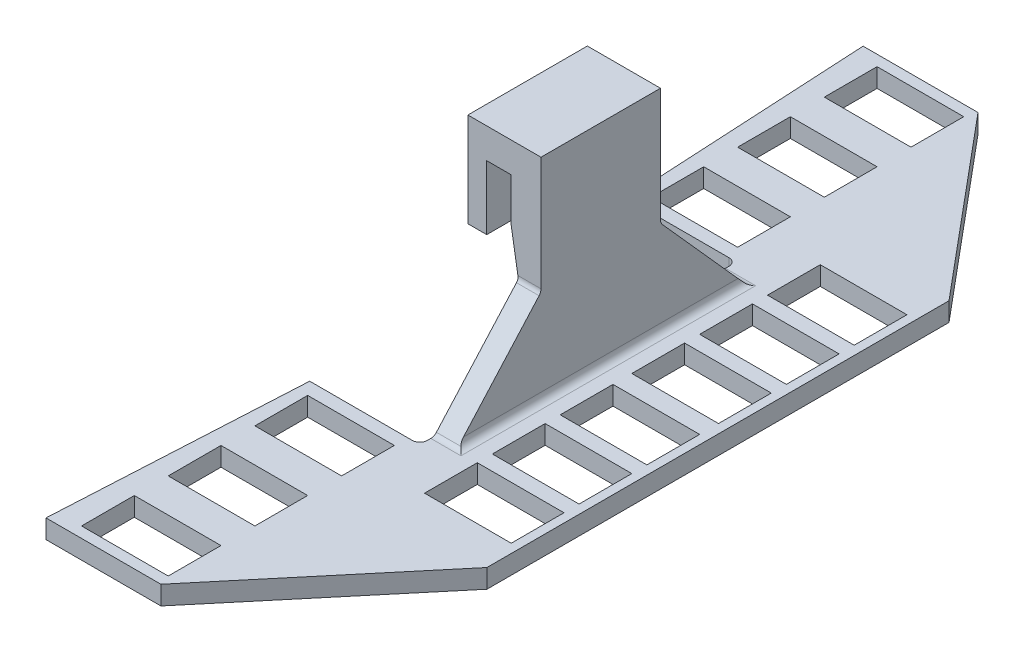
from build123d import *

# Parameters (mm, degrees)
RESSALTO_EXTRUS_O1_DEPTH  = 2.5
ESBO_O2_W                 = 3
ESBO_O2_H                 = 66
RESSALTO_EXTRUS_O2_DEPTH  = 12.5
ESBO_O4_W                 = 4
ESBO_O4_H                 = 11.5
ESBO_O4_W_2               = 2.5
ESBO_O4_H_2               = 8.5
RESSALTO_EXTRUS_O4_DEPTH  = 7.925
CHANFRO1_SIZE2            = 6
CHANFRO1_SIZE             = 1
CHANFRO2_SIZE             = 12
CORTE_EXTRUS_O2_DEPTH     = 3
CORTE_EXTRUS_O1_REACH     = 67.702
ESBO_O5_W                 = 11.5
ESBO_O5_H                 = 7
PADR_O_LINEAR1_COUNT      = 3
PADR_O_LINEAR1_PITCH      = 9
ESBO_O8_W                 = 11.5
ESBO_O8_H                 = 7
CORTE_EXTRUS_O4_DEPTH     = 10
PADR_O_LINEAR3_COUNT      = 3
PADR_O_LINEAR3_PITCH      = 11.5
ESPELHAR1_COPY_1_SKETCH_W = 11.5
ESPELHAR1_COPY_1_SKETCH_H = 7
ESPELHAR1_COPY_1_DEPTH    = 10
ESPELHAR1_COPY_2_SKETCH_W = 11.5
ESPELHAR1_COPY_2_SKETCH_H = 7
ESPELHAR1_COPY_2_DEPTH    = 10
ESPELHAR2_COPY_1_REACH    = 67.702
ESPELHAR2_COPY_1_SKETCH_W = 11.5
ESPELHAR2_COPY_1_SKETCH_H = 7
ESPELHAR2_COPY_2_REACH    = 67.702
ESPELHAR2_COPY_2_SKETCH_W = 11.5
ESPELHAR2_COPY_2_SKETCH_H = 7
FILETE3_R                 = 1
FILETE5_R                 = 1


# Some blends are built 0.0001 mm under size
with BuildPart() as part:
    # Esboço1 → Ressalto-extrusão1 (new body)
    with BuildSketch(Plane(origin=(0, 0, 0), x_dir=(1, 0, 0), z_dir=(0, 1, 0))):
        Polygon((-24.393815238, -54.2), (-9.15, -54.2), (10.553192421, -30.65), (10.553192421, 30.65), (-9.15, 54.2), (-24.393815238, 54.2), (-22.610275313, 21), (-8, 21), (-8, -21), (-22.610275313, -21), align=None)
    extrude(amount=RESSALTO_EXTRUS_O1_DEPTH)

    # Esboço2 → Ressalto-extrusão2 (add)
    with BuildSketch(Plane(origin=(0, 2.5, 0), x_dir=(1, 0, 0), z_dir=(0, 1, 0))):
        with Locations((-6.5, 0)):
            Rectangle(ESBO_O2_W, ESBO_O2_H)
    extrude(amount=RESSALTO_EXTRUS_O2_DEPTH)

    # Esboço4 → Ressalto-extrusão4 (add, symmetric)
    with BuildSketch(Plane.XY):
        with Locations((-7, 20.75)):
            Rectangle(ESBO_O4_W, ESBO_O4_H)
        Polygon((-9, 26.5), (-5, 26.5), (-5, 30.5), (-14.7, 30.5), (-14.7, 26.5), (-12.2, 26.5), align=None)
        with Locations((-13.45, 22.25)):
            Rectangle(ESBO_O4_W_2, ESBO_O4_H_2)
    extrude(amount=RESSALTO_EXTRUS_O4_DEPTH, both=True)

    # Chanfro1
    chanfro1_edges = [part.edges().sort_by_distance(p)[0] for p in [
        (-9, 15, 0),
    ]]
    chanfro1_side = [part.faces().sort_by_distance(p)[0] for p in [
        (-8.98, 15, 0),
    ]]
    chamfer(chanfro1_edges, length=CHANFRO1_SIZE - 0.0001, length2=CHANFRO1_SIZE2 - 0.0001, reference=chanfro1_side[0])  # a hair under: the kernel refuses the full size

    # Chanfro2
    chanfro2_edges = [part.edges().sort_by_distance(p)[0] for p in [
        (-6.5, 15, 33),
        (-6.5, 15, -33),
    ]]
    chamfer(chanfro2_edges, length=CHANFRO2_SIZE)

    # Esboço6 → Corte-extrusão2 (cut)
    with BuildSketch(Plane(origin=(-5, 0, 0), x_dir=(0, 0, -1), z_dir=(1, 0, 0))):
        Polygon((-7.92, 15), (-33, 15), (-33, 2.5), (-19.1, 2.5), align=None)
    corte_extrus_o2 = extrude(amount=-CORTE_EXTRUS_O2_DEPTH, mode=Mode.SUBTRACT)

    # Esboço5 → Corte-extrusão1 (cut, up to next)
    with BuildSketch(Plane(origin=(0, 2.5, 0), x_dir=(1, 0, 0), z_dir=(0, 1, 0)), mode=Mode.PRIVATE) as corte_extrus_o1_sk1:
        with Locations((3.624348025, -4.75)):
            Rectangle(ESBO_O5_W, ESBO_O5_H)
    corte_extrus_o1_tool1 = extrude(corte_extrus_o1_sk1.sketch, amount=-CORTE_EXTRUS_O1_REACH, mode=Mode.PRIVATE) & part.part
    corte_extrus_o1 = corte_extrus_o1_tool1.solids().sort_by_distance((3.624348, 2.5, 4.75))[0]
    add(corte_extrus_o1, mode=Mode.SUBTRACT)

    # Padrão linear1: Corte-extrusão1 ×3
    with Locations(*[(0, 0, i * PADR_O_LINEAR1_PITCH) for i in range(1, PADR_O_LINEAR1_COUNT)]):
        add(corte_extrus_o1, mode=Mode.SUBTRACT)

    # Esboço8 → Corte-extrusão4 (cut)
    with BuildSketch(Plane(origin=(0, 2.5, 0), x_dir=(1, 0, 0), z_dir=(0, 1, 0))):
        with Locations((-15.36, 26.27)):
            Rectangle(ESBO_O8_W, ESBO_O8_H)
    corte_extrus_o4 = extrude(amount=-CORTE_EXTRUS_O4_DEPTH, mode=Mode.SUBTRACT)

    # Padrão linear3: Corte-extrusão4 ×3
    with Locations(*[(0, 0, -i * PADR_O_LINEAR3_PITCH) for i in range(1, PADR_O_LINEAR3_COUNT)]):
        add(corte_extrus_o4, mode=Mode.SUBTRACT)

    # Espelhar1: Corte-extrusão4 across plane
    add(corte_extrus_o4.mirror(Plane.XY), mode=Mode.SUBTRACT)

    # Espelhar1 copy 1 sketch → Espelhar1 copy 1 (cut)
    with BuildSketch(Plane(origin=(0, 2.5, 11.5), x_dir=(1, 0, 0), z_dir=(0, 1, 0))):
        with Locations((-15.36, -26.27)):
            Rectangle(ESPELHAR1_COPY_1_SKETCH_W, ESPELHAR1_COPY_1_SKETCH_H)
    extrude(amount=-ESPELHAR1_COPY_1_DEPTH, mode=Mode.SUBTRACT)

    # Espelhar1 copy 2 sketch → Espelhar1 copy 2 (cut)
    with BuildSketch(Plane(origin=(0, 2.5, 23), x_dir=(1, 0, 0), z_dir=(0, 1, 0))):
        with Locations((-15.36, -26.27)):
            Rectangle(ESPELHAR1_COPY_2_SKETCH_W, ESPELHAR1_COPY_2_SKETCH_H)
    extrude(amount=-ESPELHAR1_COPY_2_DEPTH, mode=Mode.SUBTRACT)

    # Espelhar2: Corte-extrusão1 across plane
    add(corte_extrus_o1.mirror(Plane.XY), mode=Mode.SUBTRACT)

    # Espelhar2 copy 1 sketch → Espelhar2 copy 1 (cut, up to next)
    with BuildSketch(Plane(origin=(0, 2.5, -9), x_dir=(1, 0, 0), z_dir=(0, 1, 0)), mode=Mode.PRIVATE) as espelhar2_copy_1_sk1:
        with Locations((3.624348025, 4.75)):
            Rectangle(ESPELHAR2_COPY_1_SKETCH_W, ESPELHAR2_COPY_1_SKETCH_H)
    espelhar2_copy_1_tool1 = extrude(espelhar2_copy_1_sk1.sketch, amount=-ESPELHAR2_COPY_1_REACH, mode=Mode.PRIVATE) & part.part
    add(espelhar2_copy_1_tool1.solids().sort_by_distance((3.624348, 2.5, -13.75))[0], mode=Mode.SUBTRACT)

    # Espelhar2 copy 2 sketch → Espelhar2 copy 2 (cut, up to next)
    with BuildSketch(Plane(origin=(0, 2.5, -18), x_dir=(1, 0, 0), z_dir=(0, 1, 0)), mode=Mode.PRIVATE) as espelhar2_copy_2_sk1:
        with Locations((3.624348025, 4.75)):
            Rectangle(ESPELHAR2_COPY_2_SKETCH_W, ESPELHAR2_COPY_2_SKETCH_H)
    espelhar2_copy_2_tool1 = extrude(espelhar2_copy_2_sk1.sketch, amount=-ESPELHAR2_COPY_2_REACH, mode=Mode.PRIVATE) & part.part
    add(espelhar2_copy_2_tool1.solids().sort_by_distance((3.624348, 2.5, -22.75))[0], mode=Mode.SUBTRACT)

    # Espelhar3: Corte-extrusão2 across plane
    add(corte_extrus_o2.mirror(Plane.XY), mode=Mode.SUBTRACT)

    # Filete3
    # the kernel refuses this fillet: 1 mm, written as the material it adds along each edge
    with BuildSketch(Plane(origin=(-8, 0, 21), x_dir=(-1, 0, 0), z_dir=(0, 1, 0)), Plane(origin=(-8, 0, -21), x_dir=(0, 0, 1), z_dir=(0, 1, 0))) as filete3_piece_1:
        with BuildLine():
            CenterArc((FILETE3_R, -FILETE3_R), FILETE3_R, 90, 90)
            Line((0, -FILETE3_R), (0, 0))
            Line((0, 0), (FILETE3_R, 0))
        make_face()
    extrude(amount=2.5)
    with BuildSketch(Plane(origin=(-5, 2.5, 19.1), x_dir=(0, 0, 1), z_dir=(-1, 0, 0))) as filete3_piece_2:
        with BuildLine():
            CenterArc((FILETE3_R * 0.44722265932, FILETE3_R), FILETE3_R, 221.809449368, 48.190550632)
            Line((-FILETE3_R * 0.298143403972, FILETE3_R * 0.333344592992), (0, 0))
            Line((0, 0), (FILETE3_R * 0.44722265932, 0))
        make_face()
    extrude(amount=3)
    with BuildSketch(Plane(origin=(-5, 2.5, -19.1), x_dir=(0, 0, -1), z_dir=(-1, 0, 0))) as filete3_piece_3:
        with BuildLine():
            CenterArc((FILETE3_R * 0.44722265932, -FILETE3_R), FILETE3_R, 90, 48.190550632)
            Line((-FILETE3_R * 0.298143403972, -FILETE3_R * 0.333344592992), (0, 0))
            Line((0, 0), (FILETE3_R * 0.44722265932, 0))
        make_face()
    extrude(amount=3)
    with BuildSketch(Plane(origin=(-5, 2.5, 21.6), x_dir=(1, 0, 0), z_dir=(0, 0, -1))) as filete3_piece_4_section:
        with BuildLine():
            CenterArc((FILETE3_R, -FILETE3_R), FILETE3_R, 90, 90)
            Line((0, -FILETE3_R), (0, 0))
            Line((0, 0), (FILETE3_R, 0))
        make_face()
    filete3_piece_4 = extrude(amount=43.2, mode=Mode.PRIVATE)
    filete3_piece_4 = split(filete3_piece_4, bisect_by=Plane(origin=(-5, 1.257744209, 20.211073579), z_dir=(0, -0.6666554070080641, -0.7453660632916638)), keep=Keep.TOP, mode=Mode.PRIVATE)
    filete3_piece_4 = split(filete3_piece_4, bisect_by=Plane(origin=(-5, 22.723924273, -1.01172213), z_dir=(0, -0.6666554070080641, 0.7453660632916638)), keep=Keep.TOP, mode=Mode.PRIVATE)
    add(filete3_piece_4)
    with BuildSketch(Plane(origin=(-5, 2.5, 21.6), x_dir=(1, 0, 0), z_dir=(0, 0, -1))) as filete3_piece_5a_section:
        with BuildLine():
            CenterArc((FILETE3_R, -FILETE3_R), FILETE3_R, 90, 90)
            Line((0, -FILETE3_R), (0, 0))
            Line((0, 0), (FILETE3_R, 0))
        make_face()
    filete3_piece_5a = extrude(amount=43.2, mode=Mode.PRIVATE)
    filete3_piece_5a = split(filete3_piece_5a, bisect_by=Plane(origin=(-5, 1.257744209, 20.211073579), z_dir=(0, 0.6666554070080641, 0.7453660632916638)), keep=Keep.TOP, mode=Mode.PRIVATE)
    with BuildSketch(Plane(origin=(-3.881943352, 2.5, 19.1), x_dir=(0, 0, 1), z_dir=(-1, 0, 0))) as filete3_piece_5b_section:
        with BuildLine():
            CenterArc((FILETE3_R * 0.44722265932, FILETE3_R), FILETE3_R, 221.809449368, 48.190550632)
            Line((-FILETE3_R * 0.298143403972, FILETE3_R * 0.333344592992), (0, 0))
            Line((0, 0), (FILETE3_R * 0.44722265932, 0))
        make_face()
    filete3_piece_5b = extrude(amount=4.118056648, mode=Mode.PRIVATE)
    filete3_piece_5b = split(filete3_piece_5b, bisect_by=Plane(origin=(-5, 2.5, 19.1), z_dir=(1, 0, 0)), keep=Keep.TOP, mode=Mode.PRIVATE)
    filete3_piece_5 = filete3_piece_5a & filete3_piece_5b
    add(filete3_piece_5)
    with BuildSketch(Plane(origin=(-3.881943352, 2.5, -19.1), x_dir=(0, 0, -1), z_dir=(-1, 0, 0))) as filete3_piece_6a_section:
        with BuildLine():
            CenterArc((FILETE3_R * 0.44722265932, -FILETE3_R), FILETE3_R, 90, 48.190550632)
            Line((-FILETE3_R * 0.298143403972, -FILETE3_R * 0.333344592992), (0, 0))
            Line((0, 0), (FILETE3_R * 0.44722265932, 0))
        make_face()
    filete3_piece_6a = extrude(amount=4.118056648, mode=Mode.PRIVATE)
    filete3_piece_6a = split(filete3_piece_6a, bisect_by=Plane(origin=(-5, 2.5, -19.1), z_dir=(1, 0, 0)), keep=Keep.TOP, mode=Mode.PRIVATE)
    with BuildSketch(Plane(origin=(-5, 2.5, 21.6), x_dir=(1, 0, 0), z_dir=(0, 0, -1))) as filete3_piece_6b_section:
        with BuildLine():
            CenterArc((FILETE3_R, -FILETE3_R), FILETE3_R, 90, 90)
            Line((0, -FILETE3_R), (0, 0))
            Line((0, 0), (FILETE3_R, 0))
        make_face()
    filete3_piece_6b = extrude(amount=43.2, mode=Mode.PRIVATE)
    filete3_piece_6b = split(filete3_piece_6b, bisect_by=Plane(origin=(-5, 22.723924273, -1.01172213), z_dir=(0, 0.6666554070080641, -0.7453660632916638)), keep=Keep.TOP, mode=Mode.PRIVATE)
    filete3_piece_6 = filete3_piece_6a & filete3_piece_6b
    add(filete3_piece_6)
    # the kernel refuses this fillet: 1 mm, written as the material it takes off along each edge
    with BuildSketch(Plane(origin=(-4.750312696, 15, -7.925), x_dir=(0, 0, 1), z_dir=(-1, 0, 0))) as filete3_2_piece_1:
        with BuildLine():
            CenterArc((1, 0.099874922), FILETE3_R, 180, 5.731967965)
            Line((0, 0.099874922), (0, 0))
            Line((0, 0), (0.005, 0))
        make_face()
    extrude(amount=3.499374609, mode=Mode.SUBTRACT)
    with BuildSketch(Plane(origin=(-4.750312696, 15, 7.925), x_dir=(0, 0, -1), z_dir=(-1, 0, 0))) as filete3_2_piece_2:
        with BuildLine():
            CenterArc((1, -0.099874922), FILETE3_R, 174.268032035, 5.731967965)
            Line((0, -0.099874922), (0, 0))
            Line((0, 0), (0.005, 0))
        make_face()
    extrude(amount=3.499374609, mode=Mode.SUBTRACT)

    # Filete5
    # the kernel refuses this fillet: 1 mm, written as the material it adds along each edge
    with BuildSketch(Plane(origin=(-5, 15, -7.92), x_dir=(0, -0.7453660632967485, -0.666655407002379), z_dir=(-1, 0, 0))) as filete5_piece_1_section:
        with BuildLine():
            CenterArc((0.389457483, -1), FILETE5_R, 90, 41.809449368)
            Line((-0.277197924, -0.254633937), (-0.343863465, -0.18009733))
            ThreePointArc((-0.343863465, -0.18009733), (-0.137775641, 0.004227619), (-0.073776551, 0.067505708))
            Line((-0.073776551, 0.067505708), (0, 0.1))
            Line((0, 0.1), (0.389457483, 0.1))
            Line((0.389457483, 0.1), (0.389457483, 0))
        make_face()
    filete5_piece_1 = extrude(amount=3, mode=Mode.PRIVATE)
    filete5_piece_1 = split(filete5_piece_1, bisect_by=Plane(origin=(-5, 15, -7.92), z_dir=(0, -1, 0)), keep=Keep.TOP, mode=Mode.PRIVATE)
    filete5_piece_1 = split(filete5_piece_1, bisect_by=Plane(origin=(-7.919029365, 14.513535649, -7.92), z_dir=(0.9863961453920427, 0.1643856573905407, 0)), keep=Keep.TOP, mode=Mode.PRIVATE)
    add(filete5_piece_1)
    with BuildSketch(Plane(origin=(-5, 15, -7.92), x_dir=(0, -0.7453660632967485, -0.666655407002379), z_dir=(-1, 0, 0))) as filete5_piece_2_section:
        with BuildLine():
            CenterArc((0.389457483, -1), FILETE5_R, 90, 41.809449368)
            Line((-0.277197924, -0.254633937), (-0.343863465, -0.18009733))
            ThreePointArc((-0.343863465, -0.18009733), (-0.137775641, 0.004227619), (-0.073776551, 0.067505708))
            Line((-0.073776551, 0.067505708), (0, 0.1))
            Line((0, 0.1), (0.389457483, 0.1))
            Line((0.389457483, 0.1), (0.389457483, 0))
        make_face()
    filete5_piece_2 = extrude(amount=3, mode=Mode.PRIVATE)
    filete5_piece_2 = split(filete5_piece_2, bisect_by=Plane(origin=(-5, 15, -7.92), z_dir=(0, 1, 0)), keep=Keep.TOP, mode=Mode.PRIVATE)
    add(filete5_piece_2)
    with BuildSketch(Plane(origin=(-5, 15, -7.92), x_dir=(0, -0.7453660632967485, -0.666655407002379), z_dir=(-1, 0, 0))) as filete5_piece_3_section:
        with BuildLine():
            CenterArc((0.389457483, -1), FILETE5_R, 90, 41.809449368)
            Line((-0.277197924, -0.254633937), (-0.343863465, -0.18009733))
            ThreePointArc((-0.343863465, -0.18009733), (-0.137775641, 0.004227619), (-0.073776551, 0.067505708))
            Line((-0.073776551, 0.067505708), (0, 0.1))
            Line((0, 0.1), (0.389457483, 0.1))
            Line((0.389457483, 0.1), (0.389457483, 0))
        make_face()
    filete5_piece_3 = extrude(amount=3, mode=Mode.PRIVATE)
    filete5_piece_3 = split(filete5_piece_3, bisect_by=Plane(origin=(-7.919029365, 14.513535649, -7.92), z_dir=(-0.9863961453920427, -0.1643856573905407, 0)), keep=Keep.TOP, mode=Mode.PRIVATE)
    add(filete5_piece_3)
    with BuildSketch(Plane(origin=(-5, 15, -7.92), x_dir=(0, -0.7453660632967485, -0.666655407002379), z_dir=(-1, 0, 0))) as filete5_piece_4_section:
        with BuildLine():
            CenterArc((0.389457483, -1), FILETE5_R, 90, 41.809449368)
            Line((-0.277197924, -0.254633937), (-0.343863465, -0.18009733))
            ThreePointArc((-0.343863465, -0.18009733), (-0.137775641, 0.004227619), (-0.073776551, 0.067505708))
            Line((-0.073776551, 0.067505708), (0, 0.1))
            Line((0, 0.1), (0.389457483, 0.1))
            Line((0.389457483, 0.1), (0.389457483, 0))
        make_face()
    filete5_piece_4 = extrude(amount=3.973643707, mode=Mode.PRIVATE)
    filete5_piece_4 = split(filete5_piece_4, bisect_by=Plane(origin=(-8, 15, -7.92), z_dir=(-1, 0, 0)), keep=Keep.TOP, mode=Mode.PRIVATE)
    filete5_piece_4 = split(filete5_piece_4, bisect_by=Plane(origin=(-7.919029365, 14.513535649, -7.92), z_dir=(0.9863961453920427, 0.1643856573905407, 0)), keep=Keep.TOP, mode=Mode.PRIVATE)
    add(filete5_piece_4)
    with BuildSketch(Plane(origin=(-5, 15, 7.92), x_dir=(0, -0.7453660632826157, 0.6666554070181805), z_dir=(-1, 0, 0))) as filete5_piece_5_section:
        with BuildLine():
            CenterArc((0.389457483, 1), FILETE5_R, 228.190550632, 41.809449368)
            Line((-0.277197924, 0.254633937), (-0.343863465, 0.18009733))
            ThreePointArc((-0.343863465, 0.18009733), (-0.137775641, -0.004227619), (-0.073776551, -0.067505708))
            Line((-0.073776551, -0.067505708), (0, -0.1))
            Line((0, -0.1), (0.389457483, -0.1))
            Line((0.389457483, -0.1), (0.389457483, 0))
        make_face()
    filete5_piece_5 = extrude(amount=3, mode=Mode.PRIVATE)
    filete5_piece_5 = split(filete5_piece_5, bisect_by=Plane(origin=(-5, 15, 7.92), z_dir=(0, -1, 0)), keep=Keep.TOP, mode=Mode.PRIVATE)
    filete5_piece_5 = split(filete5_piece_5, bisect_by=Plane(origin=(-7.919029365, 14.513535649, 7.92), z_dir=(0.9863961453920427, 0.1643856573905407, 0)), keep=Keep.TOP, mode=Mode.PRIVATE)
    add(filete5_piece_5)
    with BuildSketch(Plane(origin=(-5, 15, 7.92), x_dir=(0, -0.7453660632826157, 0.6666554070181805), z_dir=(-1, 0, 0))) as filete5_piece_6_section:
        with BuildLine():
            CenterArc((0.389457483, 1), FILETE5_R, 228.190550632, 41.809449368)
            Line((-0.277197924, 0.254633937), (-0.343863465, 0.18009733))
            ThreePointArc((-0.343863465, 0.18009733), (-0.137775641, -0.004227619), (-0.073776551, -0.067505708))
            Line((-0.073776551, -0.067505708), (0, -0.1))
            Line((0, -0.1), (0.389457483, -0.1))
            Line((0.389457483, -0.1), (0.389457483, 0))
        make_face()
    filete5_piece_6 = extrude(amount=3, mode=Mode.PRIVATE)
    filete5_piece_6 = split(filete5_piece_6, bisect_by=Plane(origin=(-5, 15, 7.92), z_dir=(0, 1, 0)), keep=Keep.TOP, mode=Mode.PRIVATE)
    add(filete5_piece_6)
    with BuildSketch(Plane(origin=(-5, 15, 7.92), x_dir=(0, -0.7453660632826157, 0.6666554070181805), z_dir=(-1, 0, 0))) as filete5_piece_7_section:
        with BuildLine():
            CenterArc((0.389457483, 1), FILETE5_R, 228.190550632, 41.809449368)
            Line((-0.277197924, 0.254633937), (-0.343863465, 0.18009733))
            ThreePointArc((-0.343863465, 0.18009733), (-0.137775641, -0.004227619), (-0.073776551, -0.067505708))
            Line((-0.073776551, -0.067505708), (0, -0.1))
            Line((0, -0.1), (0.389457483, -0.1))
            Line((0.389457483, -0.1), (0.389457483, 0))
        make_face()
    filete5_piece_7 = extrude(amount=3, mode=Mode.PRIVATE)
    filete5_piece_7 = split(filete5_piece_7, bisect_by=Plane(origin=(-7.919029365, 14.513535649, 7.92), z_dir=(-0.9863961453920427, -0.1643856573905407, 0)), keep=Keep.TOP, mode=Mode.PRIVATE)
    add(filete5_piece_7)
    with BuildSketch(Plane(origin=(-5, 15, 7.92), x_dir=(0, -0.7453660632826157, 0.6666554070181805), z_dir=(-1, 0, 0))) as filete5_piece_8_section:
        with BuildLine():
            CenterArc((0.389457483, 1), FILETE5_R, 228.190550632, 41.809449368)
            Line((-0.277197924, 0.254633937), (-0.343863465, 0.18009733))
            ThreePointArc((-0.343863465, 0.18009733), (-0.137775641, -0.004227619), (-0.073776551, -0.067505708))
            Line((-0.073776551, -0.067505708), (0, -0.1))
            Line((0, -0.1), (0.389457483, -0.1))
            Line((0.389457483, -0.1), (0.389457483, 0))
        make_face()
    filete5_piece_8 = extrude(amount=3.973643707, mode=Mode.PRIVATE)
    filete5_piece_8 = split(filete5_piece_8, bisect_by=Plane(origin=(-8, 15, 7.92), z_dir=(-1, 0, 0)), keep=Keep.TOP, mode=Mode.PRIVATE)
    filete5_piece_8 = split(filete5_piece_8, bisect_by=Plane(origin=(-7.919029365, 14.513535649, 7.92), z_dir=(0.9863961453920427, 0.1643856573905407, 0)), keep=Keep.TOP, mode=Mode.PRIVATE)
    add(filete5_piece_8)


solid = part.part
